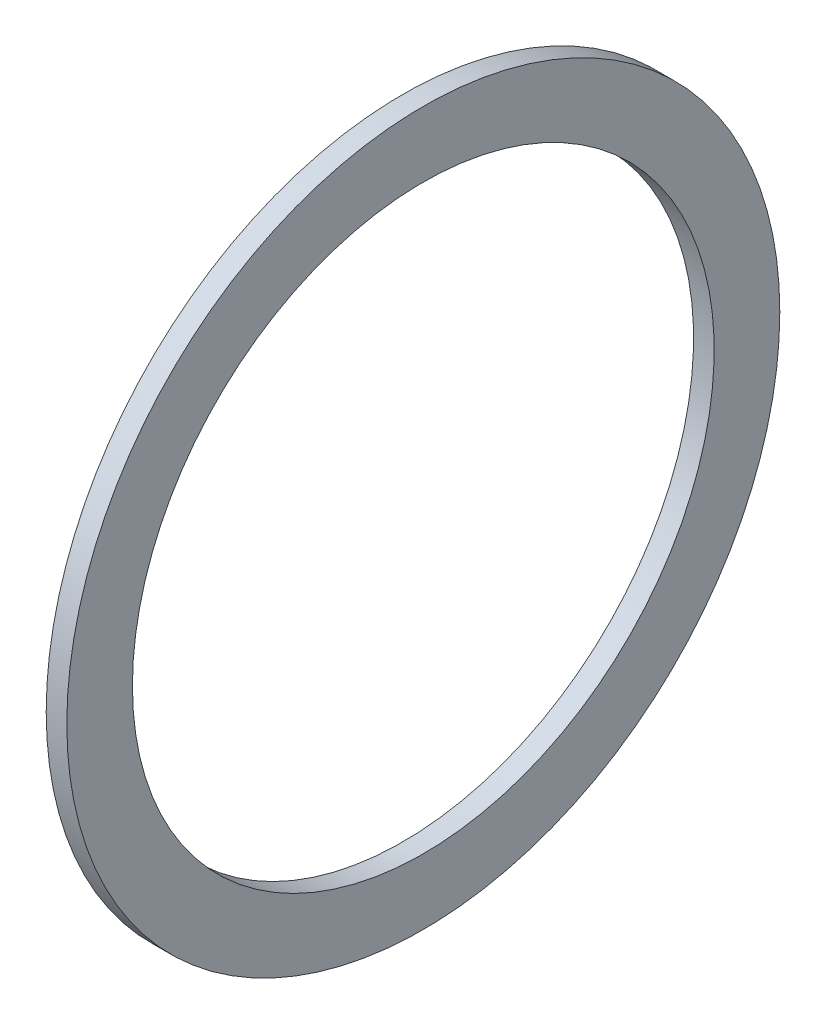
from build123d import *

# Parameters (mm, degrees)
SKETCH3_W = 3.175
SKETCH3_H = 10.111500097


with BuildPart() as part:
    # Sketch3 → Revolve1 (revolve)
    with BuildSketch(Plane.XY):
        with Locations((6.572300038, 49.880749933)):
            Rectangle(SKETCH3_W, SKETCH3_H)
    revolve(axis=Axis((0, 0, 0), (1, 0, 0)))


solid = part.part
